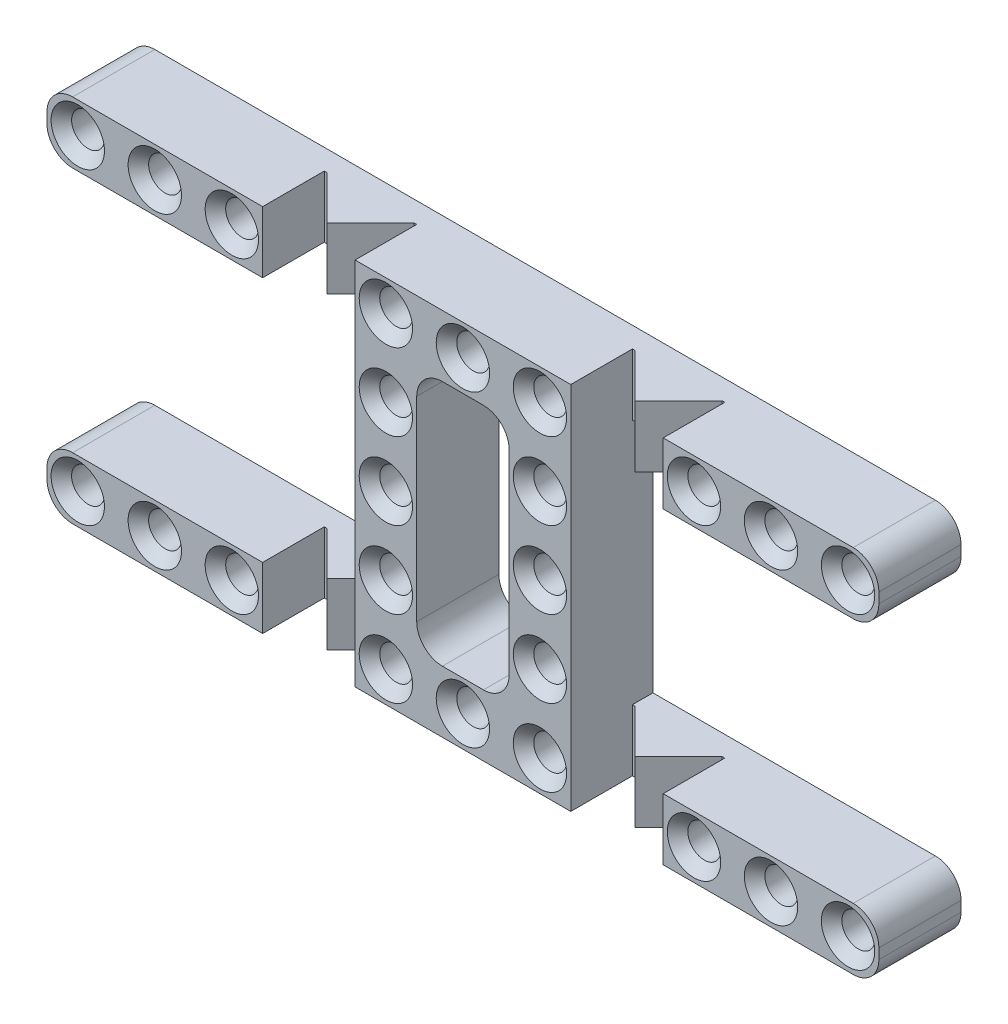
from build123d import *

# Parameters (mm, degrees)
SKETCH1_R             = 1.6
BOSS_EXTRUDE1_DEPTH   = 8
SKETCH2_W             = 9
SKETCH2_H             = 8.199711987
CUT_EXTRUDE1_DEPTH    = 8
BOSS_EXTRUDE2_DEPTH   = 6
SKETCH4_R             = 1.6
BOSS_EXTRUDE3_DEPTH   = 8
SKETCH5_W             = 24.599859369
SKETCH5_H             = 11.841190876
CUT_EXTRUDE2_DEPTH    = 10
SKETCH6_W             = 21
SKETCH6_H             = 36
SKETCH6_R             = 1.6
SKETCH6_W_2           = 9
SKETCH6_H_2           = 24
BOSS_EXTRUDE4_DEPTH   = 8
LPATTERN1_OUTLINE_R   = 1.6
LPATTERN1_DEPTH       = 8
LPATTERN1_2_OUTLINE_W = 9
LPATTERN1_2_OUTLINE_H = 6
LPATTERN1_2_DEPTH     = 2
LPATTERN1_START       = -33
LPATTERN1_3_DEPTH     = 6
FILLET1_R             = 2.5
CHAMFER1_SIZE         = 1


with BuildPart() as part:
    # Sketch1 → Boss-Extrude1 (new body)
    with BuildSketch(Plane.XY):
        with BuildLine():
            Line((-0.5, 3), (15.5, 3))
            ThreePointArc((15.5, 3), (17.267766953, 2.267766953), (18, 0.5))
            Line((18, 0.5), (18, -0.5))
            ThreePointArc((18, -0.5), (17.267766953, -2.267766953), (15.5, -3))
            Line((15.5, -3), (-0.5, -3))
            ThreePointArc((-0.5, -3), (-2.267766953, -2.267766953), (-3, -0.5))
            Line((-3, -0.5), (-3, 0.5))
            ThreePointArc((-3, 0.5), (-2.267766953, 2.267766953), (-0.5, 3))
        make_face()
        Circle(SKETCH1_R, mode=Mode.SUBTRACT)
        with Locations((15, 0)):
            Circle(SKETCH1_R, mode=Mode.SUBTRACT)
    boss_extrude1 = extrude(amount=BOSS_EXTRUDE1_DEPTH)

    # Sketch2 → Cut-Extrude1 (cut)
    with BuildSketch(Plane.XZ.offset(3)):
        with Locations((7.5, 6.099855994)):
            Rectangle(SKETCH2_W, SKETCH2_H)
    cut_extrude1 = extrude(amount=-CUT_EXTRUDE1_DEPTH, mode=Mode.SUBTRACT)

    # Sketch3 → Boss-Extrude2 (add)
    with BuildSketch(Plane.XZ.offset(3)):
        Polygon((3.257359313, 2), (7.5, 6.242640687), (11.742640687, 2), align=None)
    boss_extrude2 = extrude(amount=-BOSS_EXTRUDE2_DEPTH)

    # Sketch4 → Boss-Extrude3 (add)
    # profile 1 of 2: a face of its own
    with BuildSketch(Plane(origin=(0, 0, 0), x_dir=(-1, 0, 0), z_dir=(0, 0, -1))):
        with BuildLine():
            Line((15.5, 3), (0.5, 3))
            ThreePointArc((0.5, 3), (2.267766953, 2.267766953), (3, 0.5))
            Line((3, 0.5), (3, -0.5))
            ThreePointArc((3, -0.5), (2.267766953, -2.267766953), (0.5, -3))
            Line((0.5, -3), (15.5, -3))
            ThreePointArc((15.5, -3), (17.267766953, -2.267766953), (18, -0.5))
            Line((18, -0.5), (18, 0.5))
            ThreePointArc((18, 0.5), (17.267766953, 2.267766953), (15.5, 3))
        make_face()
        with Locations((7.5, 0)):
            Circle(SKETCH4_R, mode=Mode.SUBTRACT)
        with Locations((15, 0)):
            Circle(SKETCH4_R, mode=Mode.SUBTRACT)
    # profile 2 of 2: a face of its own
    with BuildSketch(Plane(origin=(0, 0, 0), x_dir=(-1, 0, 0), z_dir=(0, 0, -1))):
        with BuildLine():
            ThreePointArc((-18, 0.5), (-17.267766953, 2.267766953), (-15.5, 3))
            Line((-15.5, 3), (-30.5, 3))
            ThreePointArc((-30.5, 3), (-32.267766953, 2.267766953), (-33, 0.5))
            Line((-33, 0.5), (-33, -0.5))
            ThreePointArc((-33, -0.5), (-32.267766953, -2.267766953), (-30.5, -3))
            Line((-30.5, -3), (-15.5, -3))
            ThreePointArc((-15.5, -3), (-17.267766953, -2.267766953), (-18, -0.5))
            Line((-18, -0.5), (-18, 0.5))
        make_face()
        with Locations((-30, 0)):
            Circle(SKETCH4_R, mode=Mode.SUBTRACT)
        with Locations((-22.5, 0)):
            Circle(SKETCH4_R, mode=Mode.SUBTRACT)
    boss_extrude3 = extrude(amount=-BOSS_EXTRUDE3_DEPTH)

    # Sketch5 → Cut-Extrude2 (cut)
    with BuildSketch(Plane.XY.offset(8)):
        with Locations((-9.299929685, -2.920595438)):
            Rectangle(SKETCH5_W, SKETCH5_H)
    extrude(amount=-CUT_EXTRUDE2_DEPTH, mode=Mode.SUBTRACT)

    # Sketch6 → Boss-Extrude4 (add)
    with BuildSketch(Plane(origin=(0, 0, 0), x_dir=(-1, 0, 0), z_dir=(0, 0, -1))):
        with Locations((7.5, -15)):
            Rectangle(SKETCH6_W, SKETCH6_H)
        Circle(SKETCH6_R, mode=Mode.SUBTRACT)
        with Locations((7.5, 0)):
            Circle(SKETCH6_R, mode=Mode.SUBTRACT)
        with Locations((15, 0)):
            Circle(SKETCH6_R, mode=Mode.SUBTRACT)
        with Locations((0, -7.5)):
            Circle(SKETCH6_R, mode=Mode.SUBTRACT)
        with Locations((0, -15)):
            Circle(SKETCH6_R, mode=Mode.SUBTRACT)
        with Locations((0, -22.5)):
            Circle(SKETCH6_R, mode=Mode.SUBTRACT)
        with Locations((0, -30)):
            Circle(SKETCH6_R, mode=Mode.SUBTRACT)
        with Locations(Location((15, -30, 0), (0, 0, 180))):
            Circle(SKETCH6_R, mode=Mode.SUBTRACT)
        with Locations(Location((7.5, -30, 0), (0, 0, 180))):
            Circle(SKETCH6_R, mode=Mode.SUBTRACT)
        with Locations(Location((15, -22.5, 0), (0, 0, 180))):
            Circle(SKETCH6_R, mode=Mode.SUBTRACT)
        with Locations(Location((15, -15, 0), (0, 0, 180))):
            Circle(SKETCH6_R, mode=Mode.SUBTRACT)
        with Locations(Location((15, -7.5, 0), (0, 0, 180))):
            Circle(SKETCH6_R, mode=Mode.SUBTRACT)
        with Locations((7.5, -15)):
            Rectangle(SKETCH6_W_2, SKETCH6_H_2, mode=Mode.SUBTRACT)
    boss_extrude4 = extrude(amount=-BOSS_EXTRUDE4_DEPTH)



with BuildPart() as body_2:
    # LPattern1: read off the stored shape, not the designer's step
    # LPattern1 outline → LPattern1 (new body)
    with BuildSketch(Plane.XY):
        with BuildLine():
            Line((12, -27), (12, -33))
            Line((12, -33), (30.5, -33))
            ThreePointArc((30.5, -33), (32.267766953, -32.267766953), (33, -30.5))
            Line((33, -30.5), (33, -29.5))
            ThreePointArc((33, -29.5), (32.267766953, -27.732233047), (30.5, -27))
            Line((30.5, -27), (12, -27))
        make_face()
        with Locations((15, -30)):
            Circle(LPATTERN1_OUTLINE_R, mode=Mode.SUBTRACT)
        with Locations((22.5, -30)):
            Circle(LPATTERN1_OUTLINE_R, mode=Mode.SUBTRACT)
        with Locations((30, -30)):
            Circle(LPATTERN1_OUTLINE_R, mode=Mode.SUBTRACT)
    lpattern1 = extrude(amount=LPATTERN1_DEPTH)


with BuildPart() as part_1:
    add(part.part)

    add(body_2.part)  # LPattern1 2 merges body 2
    # LPattern1 2 outline → LPattern1 2 (add)
    with BuildSketch(Plane.XY):
        with Locations((7.5, -30)):
            Rectangle(LPATTERN1_2_OUTLINE_W, LPATTERN1_2_OUTLINE_H)
    lpattern1_2 = extrude(amount=LPATTERN1_2_DEPTH)

    # LPattern1 3 outline → LPattern1 3 (add)
    with BuildSketch(Plane(origin=(0, 0, 0), x_dir=(1, 0, 0), z_dir=(0, 1, 0)).offset(LPATTERN1_START)):
        Polygon((11.742640687, -2), (3.257359313, -2), (7.5, -6.242640687), align=None)
    lpattern1_3 = extrude(amount=LPATTERN1_3_DEPTH)

    # Mirror1: Boss-Extrude1, Cut-Extrude1, Boss-Extrude2, Boss-Extrude3, Boss-Extrude4, LPattern1, LPattern1 2, LPattern1 3 across plane
    add(boss_extrude1.mirror(Plane.ZY.offset(7.5)))
    add(cut_extrude1.mirror(Plane.ZY.offset(7.5)), mode=Mode.SUBTRACT)
    add(boss_extrude2.mirror(Plane.ZY.offset(7.5)))
    add(boss_extrude3.mirror(Plane.ZY.offset(7.5)))
    add(boss_extrude4.mirror(Plane.ZY.offset(7.5)))
    add(lpattern1.mirror(Plane.ZY.offset(7.5)))
    add(lpattern1_2.mirror(Plane.ZY.offset(7.5)))
    add(lpattern1_3.mirror(Plane.ZY.offset(7.5)))

    # Fillet1
    fillet1_edges = [part_1.edges().sort_by_distance(p)[0] for p in [
        (-12, -3, 4),
        (-12, -27, 4),
        (-3, -27, 4),
        (-3, -3, 4),
    ]]
    fillet(fillet1_edges, radius=FILLET1_R)

    # Chamfer1
    chamfer1_edges = [part_1.edges().sort_by_distance(p)[0] for p in [
        (-16.6, -7.5, 8),
        (-16.6, -15, 8),
        (-16.6, -22.5, 8),
        (-9.1, -30, 8),
        (-16.6, -30, 8),
        (1.6, -30, 8),
        (1.6, -22.5, 8),
        (1.6, -15, 8),
        (1.6, -7.5, 8),
        (-13.4, 0, 8),
        (-5.9, 0, 8),
        (1.6, 0, 8),
        (1.6, 0, 0),
        (-5.9, 0, 0),
        (-13.4, 0, 0),
        (1.6, -7.5, 0),
        (1.6, -15, 0),
        (1.6, -22.5, 0),
        (1.6, -30, 0),
        (-16.6, -30, 0),
        (-9.1, -30, 0),
        (-16.6, -22.5, 0),
        (-16.6, -15, 0),
        (-16.6, -7.5, 0),
        (13.4, 0, 0),
        (13.4, 0, 8),
        (13.4, -30, 0),
        (13.4, -30, 8),
        (28.4, -30, 8),
        (20.9, -30, 8),
        (28.4, -30, 0),
        (20.9, -30, 0),
        (-28.4, 0, 8),
        (-28.4, 0, 0),
        (-46.6, 0, 0),
        (-39.1, 0, 0),
        (-46.6, 0, 8),
        (-39.1, 0, 8),
        (-28.4, -30, 8),
        (-28.4, -30, 0),
        (-43.4, -30, 0),
        (-35.9, -30, 0),
        (-43.4, -30, 8),
        (-35.9, -30, 8),
        (31.6, 0, 8),
        (24.1, 0, 8),
        (31.6, 0, 0),
        (24.1, 0, 0),
    ]]
    chamfer(chamfer1_edges, length=CHAMFER1_SIZE)


solid = part_1.part
